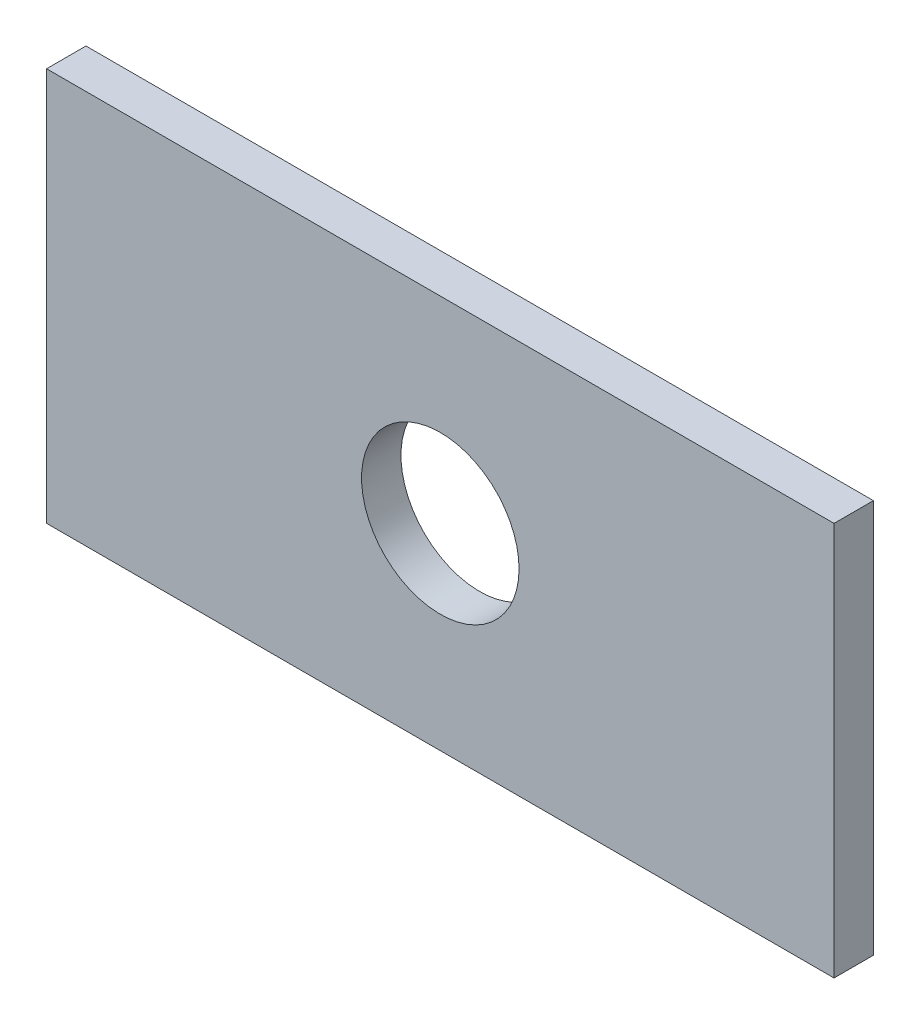
from build123d import *

# Parameters (mm, degrees)
SKETCH_1_W      = 20
SKETCH_1_H      = 10
BASEPLATE_DEPTH = 1
SKETCH_6_R      = 2
NORMALCUT_DEPTH = 23.383029286


# Sheet-metal steps are written as plain solids
with BuildPart() as part:
    # Sketch 1 → BasePlate (new body)
    with BuildSketch(Plane.XY):
        with Locations((10, 5)):
            Rectangle(SKETCH_1_W, SKETCH_1_H)
    extrude(amount=-BASEPLATE_DEPTH)

    # 草图6 → NormalCut (cut, through all)
    with BuildSketch(Plane.XY):
        with Locations((10, 5)):
            Circle(SKETCH_6_R)
    extrude(amount=-NORMALCUT_DEPTH, mode=Mode.SUBTRACT)


solid = part.part
